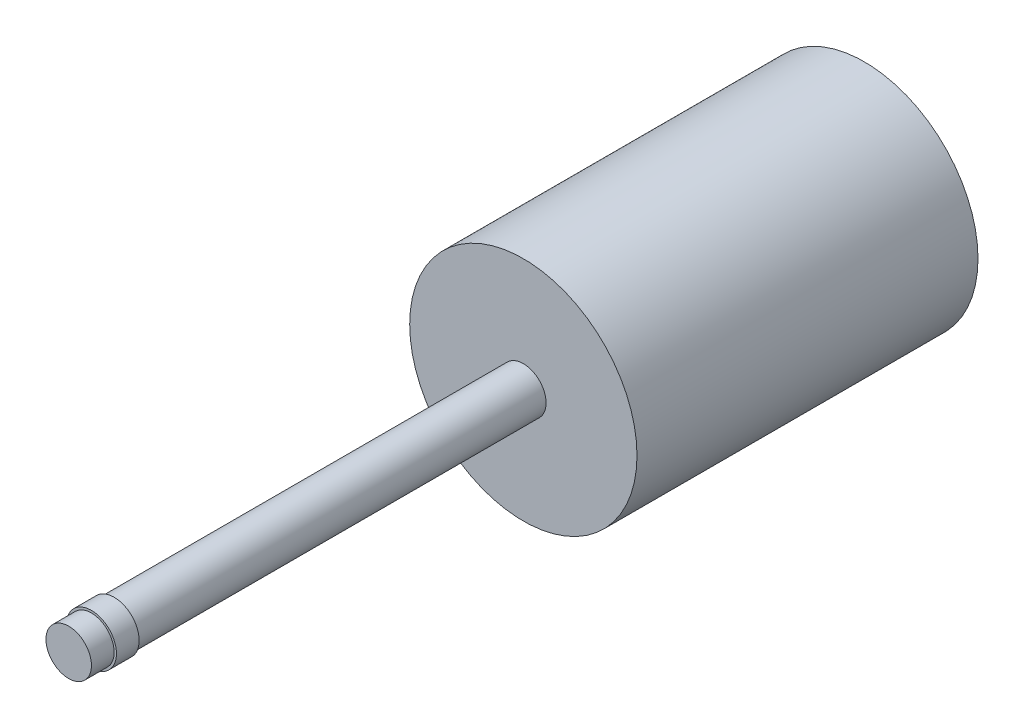
from build123d import *

# Parameters (mm, degrees)
SKETCH2_R           = 12.7
BOSS_EXTRUDE1_DEPTH = 38.1
SKETCH3_R           = 2.54
BOSS_EXTRUDE2_DEPTH = 50.8
SKETCH4_R           = 2.794
SKETCH4_R_2         = 2.54
BOSS_EXTRUDE3_DEPTH = 2.54


with BuildPart() as part:
    # Sketch2 → Boss-Extrude1 (new body)
    with BuildSketch(Plane.XY):
        Circle(SKETCH2_R)
    extrude(amount=BOSS_EXTRUDE1_DEPTH)

    # Sketch3 → Boss-Extrude2 (add)
    with BuildSketch(Plane.XY.offset(38.1)):
        Circle(SKETCH3_R)
    extrude(amount=BOSS_EXTRUDE2_DEPTH)

    # Sketch4 → Boss-Extrude3 (add)
    with BuildSketch(Plane.XY.offset(83.82)):
        Circle(SKETCH4_R)
        Circle(SKETCH4_R_2, mode=Mode.SUBTRACT)
    extrude(amount=BOSS_EXTRUDE3_DEPTH)


solid = part.part
